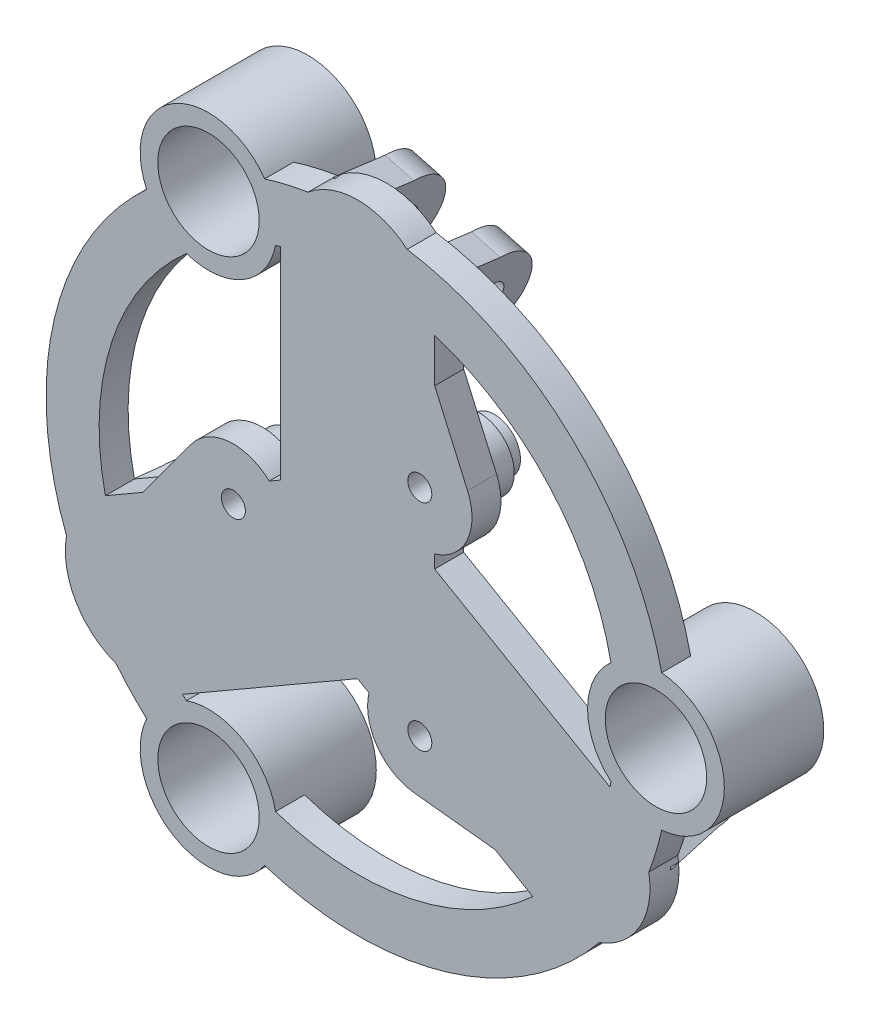
from build123d import *

# Parameters (mm, degrees)
F_01_START                              = 33.5
S01_JOINING_CENTRE_OF_FLOATING_Y_R      = 9
F_01_JOINING_CENTRE_OF_FLOATING_Y_DEPTH = 3.5
F_02_START                              = 33.5
F_02_FLOATING_SPOKE_1_DEPTH             = 3.5
F_03_START                              = 33.5
F_03_FLOATING_SPOKE_2_DEPTH             = 3.5
F_04_START                              = 33.5
F_04_FLOATING_SPOKE_3_DEPTH             = 3.5
F_05_START                              = 33.5
F_05_MOVING_TENDON_TIE_WEB_1_DEPTH      = 3.5
F_06_START                              = 29.8
S06_TENDON_ANCHOR_BASE_1_R              = 4.2
F_06_TENDON_ANCHOR_BASE_1_DEPTH         = 3.7
F_07_START                              = 28
S07_TENDON_MOUTH_1_R                    = 3.15
F_07_TENDON_MOUTH_1_DEPTH               = 1.8
F_08_START                              = 33.5
F_08_MOVING_TENDON_TIE_WEB_2_DEPTH      = 3.5
F_09_START                              = 29.8
S09_TENDON_ANCHOR_BASE_2_R              = 4.2
F_09_TENDON_ANCHOR_BASE_2_DEPTH         = 3.7
F_10_START                              = 28
S10_TENDON_MOUTH_2_R                    = 3.15
F_10_TENDON_MOUTH_2_DEPTH               = 1.8
F_11_START                              = 33.5
F_11_MOVING_TENDON_TIE_WEB_3_DEPTH      = 3.5
F_12_START                              = 29.8
S12_TENDON_ANCHOR_BASE_3_R              = 4.2
F_12_TENDON_ANCHOR_BASE_3_DEPTH         = 3.7
F_13_START                              = 28
S13_TENDON_MOUTH_3_R                    = 3.15
F_13_TENDON_MOUTH_3_DEPTH               = 1.8
F_14_START                              = 33.5
S14_JOINED_DRIVE_HOOP_R                 = 37.6
S14_JOINED_DRIVE_HOOP_R_2               = 31.2
F_14_JOINED_DRIVE_HOOP_DEPTH            = 3.5
F_15_START                              = 25
S15_SLIDING_GUIDE_BARREL_1_R            = 8.25
F_15_SLIDING_GUIDE_BARREL_1_DEPTH       = 12
F_16_START                              = 25
S16_SLIDING_GUIDE_BARREL_2_R            = 8.25
F_16_SLIDING_GUIDE_BARREL_2_DEPTH       = 12
F_17_START                              = 25
S17_SLIDING_GUIDE_BARREL_3_R            = 8.25
F_17_SLIDING_GUIDE_BARREL_3_DEPTH       = 12
F_18_START                              = 24
S18_GUIDE_BUSHING_SEATS_R               = 6.12
F_18_GUIDE_BUSHING_SEATS_DEPTH          = 14
F_19_START                              = 27.8
S19_THROUGH_TENDON_TIE_EYES_R           = 1.45
F_19_THROUGH_TENDON_TIE_EYES_DEPTH      = 10
F_20_START                              = -7.2
F_20_INTEGRAL_B1_FORK_CHEEK_L_DEPTH     = 3.6
F_21_START                              = 3.6
F_21_INTEGRAL_B1_FORK_CHEEK_R_DEPTH     = 3.6
F_22_START                              = -7.5
S22_B1_PIVOT_THROUGH_BOTH_CHEEKS_R      = 1.65
F_22_B1_PIVOT_THROUGH_BOTH_CHEEKS_DEPTH = 15
F_23_START                              = -7.3
S23_B1_RECESSED_PIVOT_SCREW_HEAD_R      = 2.7
F_23_B1_RECESSED_PIVOT_SCREW_HEAD_DEPTH = 1.5
F_24_START                              = -7.2
F_24_INTEGRAL_B2_FORK_CHEEK_L_DEPTH     = 3.6
F_25_START                              = 3.6
F_25_INTEGRAL_B2_FORK_CHEEK_R_DEPTH     = 3.6
F_26_START                              = -7.5
S26_B2_PIVOT_THROUGH_BOTH_CHEEKS_R      = 1.65
F_26_B2_PIVOT_THROUGH_BOTH_CHEEKS_DEPTH = 15
F_27_START                              = -7.3
S27_B2_RECESSED_PIVOT_SCREW_HEAD_R      = 2.7
F_27_B2_RECESSED_PIVOT_SCREW_HEAD_DEPTH = 1.5
F_28_START                              = -7.2
F_28_INTEGRAL_B3_FORK_CHEEK_L_DEPTH     = 3.6
F_29_START                              = 3.6
F_29_INTEGRAL_B3_FORK_CHEEK_R_DEPTH     = 3.6
F_30_START                              = -7.5
S30_B3_PIVOT_THROUGH_BOTH_CHEEKS_R      = 1.65
F_30_B3_PIVOT_THROUGH_BOTH_CHEEKS_DEPTH = 15
F_31_START                              = -7.3
S31_B3_RECESSED_PIVOT_SCREW_HEAD_R      = 2.7
F_31_B3_RECESSED_PIVOT_SCREW_HEAD_DEPTH = 1.5


with BuildPart() as part:
    # S01 - Joining centre of floating Y → 01 - Joining centre of floating Y (new body)
    with BuildSketch(Plane.XY.offset(F_01_START)):
        Circle(S01_JOINING_CENTRE_OF_FLOATING_Y_R)
    extrude(amount=F_01_JOINING_CENTRE_OF_FLOATING_Y_DEPTH)

    # S02 - Floating spoke 1 → 02 - Floating spoke 1 (add)
    with BuildSketch(Plane.XY.offset(F_02_START)):
        with BuildLine():
            Line((4.65, -8.054036255), (-21.330762114, -23.054036255))
            ThreePointArc((-21.330762114, -23.054036255), (-34.034798369, -19.65), (-30.630762114, -6.945963745))
            Line((-30.630762114, -6.945963745), (-4.65, 8.054036255))
            ThreePointArc((-4.65, 8.054036255), (8.054036255, 4.65), (4.65, -8.054036255))
        make_face()
    extrude(amount=F_02_FLOATING_SPOKE_1_DEPTH)

    # S03 - Floating spoke 2 → 03 - Floating spoke 2 (add)
    with BuildSketch(Plane.XY.offset(F_03_START)):
        with BuildLine():
            Line((4.65, 8.054036255), (30.630762114, -6.945963745))
            ThreePointArc((30.630762114, -6.945963745), (34.034798369, -19.65), (21.330762114, -23.054036255))
            Line((21.330762114, -23.054036255), (-4.65, -8.054036255))
            ThreePointArc((-4.65, -8.054036255), (-8.054036255, 4.65), (4.65, 8.054036255))
        make_face()
    extrude(amount=F_03_FLOATING_SPOKE_2_DEPTH)

    # S04 - Floating spoke 3 → 04 - Floating spoke 3 (add)
    with BuildSketch(Plane.XY.offset(F_04_START)):
        with BuildLine():
            Line((-9.3, 0), (-9.3, 30))
            ThreePointArc((-9.3, 30), (0, 39.3), (9.3, 30))
            Line((9.3, 30), (9.3, 0))
            ThreePointArc((9.3, 0), (0, -9.3), (-9.3, 0))
        make_face()
    extrude(amount=F_04_FLOATING_SPOKE_3_DEPTH)

    # S05 - Moving tendon tie web 1 → 05 - Moving tendon tie web 1 (add)
    with BuildSketch(Plane.XY.offset(F_05_START)):
        with BuildLine():
            Line((25.299707774, -21.263079513), (6.818945661, -19.25346057))
            ThreePointArc((6.818945661, -19.25346057), (1.236920487, -12.309326717), (8.181054339, -6.727301544))
            Line((8.181054339, -6.727301544), (26.661816453, -8.736920487))
            ThreePointArc((26.661816453, -8.736920487), (32.243841627, -15.681054339), (25.299707774, -21.263079513))
        make_face()
    extrude(amount=F_05_MOVING_TENDON_TIE_WEB_1_DEPTH)

    # S06 - Tendon anchor base 1 → 06 - Tendon anchor base 1 (add)
    with BuildSketch(Plane.XY.offset(F_06_START)):
        with Locations((7.5, -12.990381057)):
            Circle(S06_TENDON_ANCHOR_BASE_1_R)
    extrude(amount=F_06_TENDON_ANCHOR_BASE_1_DEPTH)

    # S07 - Tendon mouth 1 → 07 - Tendon mouth 1 (add)
    with BuildSketch(Plane.XY.offset(F_07_START)):
        with Locations((7.5, -12.990381057)):
            Circle(S07_TENDON_MOUTH_1_R)
    extrude(amount=F_07_TENDON_MOUTH_1_DEPTH)

    # S08 - Moving tendon tie web 2 → 08 - Moving tendon tie web 2 (add)
    with BuildSketch(Plane.XY.offset(F_08_START)):
        with BuildLine():
            Line((5.764513134, 32.541729397), (13.264513134, 15.532110454))
            ThreePointArc((13.264513134, 15.532110454), (10.041729397, 7.225867923), (1.735486866, 10.448651659))
            Line((1.735486866, 10.448651659), (-5.764513134, 27.458270603))
            ThreePointArc((-5.764513134, 27.458270603), (-2.541729397, 35.764513134), (5.764513134, 32.541729397))
        make_face()
    extrude(amount=F_08_MOVING_TENDON_TIE_WEB_2_DEPTH)

    # S09 - Tendon anchor base 2 → 09 - Tendon anchor base 2 (add)
    with BuildSketch(Plane.XY.offset(F_09_START)):
        with Locations((7.5, 12.990381057)):
            Circle(S09_TENDON_ANCHOR_BASE_2_R)
    extrude(amount=F_09_TENDON_ANCHOR_BASE_2_DEPTH)

    # S10 - Tendon mouth 2 → 10 - Tendon mouth 2 (add)
    with BuildSketch(Plane.XY.offset(F_10_START)):
        with Locations((7.5, 12.990381057)):
            Circle(S10_TENDON_MOUTH_2_R)
    extrude(amount=F_10_TENDON_MOUTH_2_DEPTH)

    # S11 - Moving tendon tie web 3 → 11 - Moving tendon tie web 3 (add)
    with BuildSketch(Plane.XY.offset(F_11_START)):
        with BuildLine():
            Line((-31.064220908, -11.278649884), (-20.083458795, 3.721350116))
            ThreePointArc((-20.083458795, 3.721350116), (-11.278649884, 5.083458795), (-9.916541205, -3.721350116))
            Line((-9.916541205, -3.721350116), (-20.897303319, -18.721350116))
            ThreePointArc((-20.897303319, -18.721350116), (-29.702112229, -20.083458795), (-31.064220908, -11.278649884))
        make_face()
    extrude(amount=F_11_MOVING_TENDON_TIE_WEB_3_DEPTH)

    # S12 - Tendon anchor base 3 → 12 - Tendon anchor base 3 (add)
    with BuildSketch(Plane.XY.offset(F_12_START)):
        with Locations((-15, 0)):
            Circle(S12_TENDON_ANCHOR_BASE_3_R)
    extrude(amount=F_12_TENDON_ANCHOR_BASE_3_DEPTH)

    # S13 - Tendon mouth 3 → 13 - Tendon mouth 3 (add)
    with BuildSketch(Plane.XY.offset(F_13_START)):
        with Locations((-15, 0)):
            Circle(S13_TENDON_MOUTH_3_R)
    extrude(amount=F_13_TENDON_MOUTH_3_DEPTH)

    # S14 - Joined drive hoop → 14 - Joined drive hoop (add)
    with BuildSketch(Plane.XY.offset(F_14_START)):
        Circle(S14_JOINED_DRIVE_HOOP_R)
        Circle(S14_JOINED_DRIVE_HOOP_R_2, mode=Mode.SUBTRACT)
    extrude(amount=F_14_JOINED_DRIVE_HOOP_DEPTH)

    # S15 - Sliding guide barrel 1 → 15 - Sliding guide barrel 1 (add)
    with BuildSketch(Plane.XY.offset(F_15_START)):
        with Locations((36, 0)):
            Circle(S15_SLIDING_GUIDE_BARREL_1_R)
    extrude(amount=F_15_SLIDING_GUIDE_BARREL_1_DEPTH)

    # S16 - Sliding guide barrel 2 → 16 - Sliding guide barrel 2 (add)
    with BuildSketch(Plane.XY.offset(F_16_START)):
        with Locations((-18, 31.176914536)):
            Circle(S16_SLIDING_GUIDE_BARREL_2_R)
    extrude(amount=F_16_SLIDING_GUIDE_BARREL_2_DEPTH)

    # S17 - Sliding guide barrel 3 → 17 - Sliding guide barrel 3 (add)
    with BuildSketch(Plane.XY.offset(F_17_START)):
        with Locations((-18, -31.176914536)):
            Circle(S17_SLIDING_GUIDE_BARREL_3_R)
    extrude(amount=F_17_SLIDING_GUIDE_BARREL_3_DEPTH)

    # S18 - Guide bushing seats → 18 - Guide bushing seats (cut)
    with BuildSketch(Plane.XY.offset(F_18_START)):
        with Locations((36, 0)):
            Circle(S18_GUIDE_BUSHING_SEATS_R)
        with Locations((-18, 31.176914536)):
            Circle(S18_GUIDE_BUSHING_SEATS_R)
        with Locations((-18, -31.176914536)):
            Circle(S18_GUIDE_BUSHING_SEATS_R)
    extrude(amount=F_18_GUIDE_BUSHING_SEATS_DEPTH, mode=Mode.SUBTRACT)

    # S19 - Through tendon tie eyes → 19 - Through tendon tie eyes (cut)
    with BuildSketch(Plane.XY.offset(F_19_START)):
        with Locations((7.5, -12.990381057)):
            Circle(S19_THROUGH_TENDON_TIE_EYES_R)
        with Locations((7.5, 12.990381057)):
            Circle(S19_THROUGH_TENDON_TIE_EYES_R)
        with Locations((-15, 0)):
            Circle(S19_THROUGH_TENDON_TIE_EYES_R)
    extrude(amount=F_19_THROUGH_TENDON_TIE_EYES_DEPTH, mode=Mode.SUBTRACT)

    # S20 - Integral B1 fork cheek L → 20 - Integral B1 fork cheek L (add)
    with BuildSketch(Plane(origin=(2.009618943, -7.5, 0), x_dir=(0.9659258262890683, 0.2588190451025208, 0), z_dir=(-0.2588190451025208, 0.9659258262890684, 0)).offset(F_20_START)):
        with BuildLine():
            Line((-35.077774789, -34.5), (-22.877774789, -34.5))
            Line((-22.877774789, -34.5), (-24.027774789, -28))
            ThreePointArc((-24.027774789, -28), (-28.977774789, -23.05), (-33.927774789, -28))
            Line((-33.927774789, -28), (-35.077774789, -34.5))
        make_face()
    extrude(amount=F_20_INTEGRAL_B1_FORK_CHEEK_L_DEPTH)

    # S21 - Integral B1 fork cheek R → 21 - Integral B1 fork cheek R (add)
    with BuildSketch(Plane(origin=(2.009618943, -7.5, 0), x_dir=(0.9659258262890683, 0.2588190451025208, 0), z_dir=(-0.2588190451025208, 0.9659258262890684, 0)).offset(F_21_START)):
        with BuildLine():
            Line((-35.077774789, -34.5), (-22.877774789, -34.5))
            Line((-22.877774789, -34.5), (-24.027774789, -28))
            ThreePointArc((-24.027774789, -28), (-28.977774789, -23.05), (-33.927774789, -28))
            Line((-33.927774789, -28), (-35.077774789, -34.5))
        make_face()
    extrude(amount=F_21_INTEGRAL_B1_FORK_CHEEK_R_DEPTH)

    # S22 - B1 pivot through both cheeks → 22 - B1 pivot through both cheeks (cut)
    with BuildSketch(Plane(origin=(2.009618943, -7.5, 0), x_dir=(0.9659258262890683, 0.2588190451025208, 0), z_dir=(-0.2588190451025208, 0.9659258262890684, 0)).offset(F_22_START)):
        with Locations((-28.977774789, -28)):
            Circle(S22_B1_PIVOT_THROUGH_BOTH_CHEEKS_R)
    extrude(amount=F_22_B1_PIVOT_THROUGH_BOTH_CHEEKS_DEPTH, mode=Mode.SUBTRACT)

    # S23 - B1 recessed pivot screw head → 23 - B1 recessed pivot screw head (cut)
    with BuildSketch(Plane(origin=(2.009618943, -7.5, 0), x_dir=(0.9659258262890683, 0.2588190451025208, 0), z_dir=(-0.2588190451025208, 0.9659258262890684, 0)).offset(F_23_START)):
        with Locations((-28.977774789, -28)):
            Circle(S23_B1_RECESSED_PIVOT_SCREW_HEAD_R)
    extrude(amount=F_23_B1_RECESSED_PIVOT_SCREW_HEAD_DEPTH, mode=Mode.SUBTRACT)

    # S24 - Integral B2 fork cheek L → 24 - Integral B2 fork cheek L (add)
    with BuildSketch(Plane(origin=(5.490381057, 5.490381057, 0), x_dir=(0, 0, 1), z_dir=(-0.7071067811865476, -0.7071067811865475, 0)).offset(F_24_START)):
        with BuildLine():
            Line((34.5, -35.077774789), (34.5, -22.877774789))
            Line((34.5, -22.877774789), (28, -24.027774789))
            ThreePointArc((28, -24.027774789), (23.05, -28.977774789), (28, -33.927774789))
            Line((28, -33.927774789), (34.5, -35.077774789))
        make_face()
    extrude(amount=F_24_INTEGRAL_B2_FORK_CHEEK_L_DEPTH)

    # S25 - Integral B2 fork cheek R → 25 - Integral B2 fork cheek R (add)
    with BuildSketch(Plane(origin=(5.490381057, 5.490381057, 0), x_dir=(0, 0, 1), z_dir=(-0.7071067811865476, -0.7071067811865475, 0)).offset(F_25_START)):
        with BuildLine():
            Line((34.5, -35.077774789), (34.5, -22.877774789))
            Line((34.5, -22.877774789), (28, -24.027774789))
            ThreePointArc((28, -24.027774789), (23.05, -28.977774789), (28, -33.927774789))
            Line((28, -33.927774789), (34.5, -35.077774789))
        make_face()
    extrude(amount=F_25_INTEGRAL_B2_FORK_CHEEK_R_DEPTH)

    # S26 - B2 pivot through both cheeks → 26 - B2 pivot through both cheeks (cut)
    with BuildSketch(Plane(origin=(5.490381057, 5.490381057, 0), x_dir=(0, 0, 1), z_dir=(-0.7071067811865476, -0.7071067811865475, 0)).offset(F_26_START)):
        with Locations((28, -28.977774789)):
            Circle(S26_B2_PIVOT_THROUGH_BOTH_CHEEKS_R)
    extrude(amount=F_26_B2_PIVOT_THROUGH_BOTH_CHEEKS_DEPTH, mode=Mode.SUBTRACT)

    # S27 - B2 recessed pivot screw head → 27 - B2 recessed pivot screw head (cut)
    with BuildSketch(Plane(origin=(5.490381057, 5.490381057, 0), x_dir=(0, 0, 1), z_dir=(-0.7071067811865476, -0.7071067811865475, 0)).offset(F_27_START)):
        with Locations((28, -28.977774789)):
            Circle(S27_B2_RECESSED_PIVOT_SCREW_HEAD_R)
    extrude(amount=F_27_B2_RECESSED_PIVOT_SCREW_HEAD_DEPTH, mode=Mode.SUBTRACT)

    # S28 - Integral B3 fork cheek L → 28 - Integral B3 fork cheek L (add)
    with BuildSketch(Plane(origin=(-7.5, 2.009618943, 0), x_dir=(0, 0, -1), z_dir=(0.9659258262890683, -0.25881904510252113, 0)).offset(F_28_START)):
        with BuildLine():
            Line((-34.5, 35.077774789), (-34.5, 22.877774789))
            Line((-34.5, 22.877774789), (-28, 24.027774789))
            ThreePointArc((-28, 24.027774789), (-23.05, 28.977774789), (-28, 33.927774789))
            Line((-28, 33.927774789), (-34.5, 35.077774789))
        make_face()
    extrude(amount=F_28_INTEGRAL_B3_FORK_CHEEK_L_DEPTH)

    # S29 - Integral B3 fork cheek R → 29 - Integral B3 fork cheek R (add)
    with BuildSketch(Plane(origin=(-7.5, 2.009618943, 0), x_dir=(0, 0, -1), z_dir=(0.9659258262890683, -0.25881904510252113, 0)).offset(F_29_START)):
        with BuildLine():
            Line((-34.5, 35.077774789), (-34.5, 22.877774789))
            Line((-34.5, 22.877774789), (-28, 24.027774789))
            ThreePointArc((-28, 24.027774789), (-23.05, 28.977774789), (-28, 33.927774789))
            Line((-28, 33.927774789), (-34.5, 35.077774789))
        make_face()
    extrude(amount=F_29_INTEGRAL_B3_FORK_CHEEK_R_DEPTH)

    # S30 - B3 pivot through both cheeks → 30 - B3 pivot through both cheeks (cut)
    with BuildSketch(Plane(origin=(-7.5, 2.009618943, 0), x_dir=(0, 0, -1), z_dir=(0.9659258262890683, -0.25881904510252113, 0)).offset(F_30_START)):
        with Locations((-28, 28.977774789)):
            Circle(S30_B3_PIVOT_THROUGH_BOTH_CHEEKS_R)
    extrude(amount=F_30_B3_PIVOT_THROUGH_BOTH_CHEEKS_DEPTH, mode=Mode.SUBTRACT)

    # S31 - B3 recessed pivot screw head → 31 - B3 recessed pivot screw head (cut)
    with BuildSketch(Plane(origin=(-7.5, 2.009618943, 0), x_dir=(0, 0, -1), z_dir=(0.9659258262890683, -0.25881904510252113, 0)).offset(F_31_START)):
        with Locations((-28, 28.977774789)):
            Circle(S31_B3_RECESSED_PIVOT_SCREW_HEAD_R)
    extrude(amount=F_31_B3_RECESSED_PIVOT_SCREW_HEAD_DEPTH, mode=Mode.SUBTRACT)


solid = part.part
